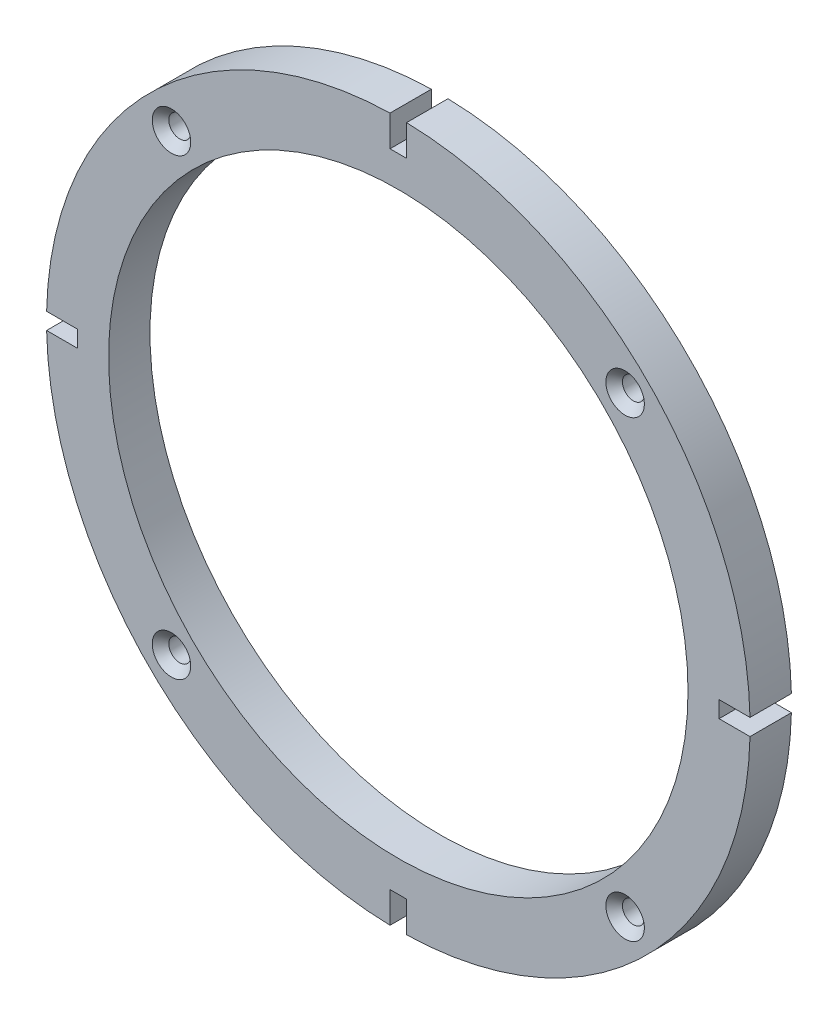
from build123d import *

# Parameters (mm, degrees)
SKETCH1_R                  = 70
BOSS_EXTRUDE1_DEPTH        = 10
SKETCH2_R                  = 2.65
WYTNIJ_WYCI_GNI_CIE1_DEPTH = 10
SZKIC1_R                   = 5
WYTNIJ_WYCI_GNI_CIE2_DEPTH = 2
SZYK_KO_OWY1_COUNT         = 4
SFAZOWANIE1_SIZE           = 2


with BuildPart() as part:
    # Sketch1 → Boss-Extrude1 (new body)
    with BuildSketch(Plane.XY):
        with BuildLine():
            ThreePointArc((2, -84.976467331), (60.104076401, -60.104076401), (84.976467331, -2))
            Line((84.976467331, -2), (77.499555144, -2))
            Line((77.499555144, -2), (77.499555144, 2))
            Line((77.499555144, 2), (84.976467331, 2))
            ThreePointArc((84.976467331, 2), (60.104076401, 60.104076401), (2, 84.976467331))
            Line((2, 84.976467331), (2, 77.499555144))
            Line((2, 77.499555144), (-2, 77.499555144))
            Line((-2, 77.499555144), (-2, 84.976467331))
            ThreePointArc((-2, 84.976467331), (-60.104076401, 60.104076401), (-84.976467331, 2))
            Line((-84.976467331, 2), (-77.499555144, 2))
            Line((-77.499555144, 2), (-77.499555144, -2))
            Line((-77.499555144, -2), (-84.976467331, -2))
            ThreePointArc((-84.976467331, -2), (-60.104076401, -60.104076401), (-2, -84.976467331))
            Line((-2, -84.976467331), (-2, -77.499555144))
            Line((-2, -77.499555144), (2, -77.499555144))
            Line((2, -77.499555144), (2, -84.976467331))
        make_face()
        Circle(SKETCH1_R, mode=Mode.SUBTRACT)
    extrude(amount=BOSS_EXTRUDE1_DEPTH)

    # Sketch2 → Wytnij-wyciągnięcie1 (cut)
    with BuildSketch(Plane(origin=(0, 0, 0), x_dir=(-1, 0, 0), z_dir=(0, 0, -1))):
        with Locations((-54.800775542, 54.800775542)):
            Circle(SKETCH2_R)
        with Locations((54.800775542, 54.800775542)):
            Circle(SKETCH2_R)
        with Locations((54.800775542, -54.800775542)):
            Circle(SKETCH2_R)
        with Locations((-54.800775542, -54.800775542)):
            Circle(SKETCH2_R)
    extrude(amount=-WYTNIJ_WYCI_GNI_CIE1_DEPTH, mode=Mode.SUBTRACT)

    # Szkic1 → Wytnij-wyciągnięcie2 (cut)
    with BuildSketch(Plane(origin=(0, 0, 0), x_dir=(-1, 0, 0), z_dir=(0, 0, -1))):
        with Locations((-54.800775542, 54.800775542)):
            Circle(SZKIC1_R)
    wytnij_wyci_gni_cie2 = extrude(amount=-WYTNIJ_WYCI_GNI_CIE2_DEPTH, mode=Mode.SUBTRACT)

    # Szyk kołowy1: Wytnij-wyciągnięcie2 ×4 about axis
    szyk_ko_owy1_axis = Axis((0, 0, 10), (0, 0, -1))
    for i in range(1, SZYK_KO_OWY1_COUNT):
        add(wytnij_wyci_gni_cie2.rotate(szyk_ko_owy1_axis, i * 360 / SZYK_KO_OWY1_COUNT), mode=Mode.SUBTRACT)

    # Sfazowanie1
    sfazowanie1_edges = [part.edges().sort_by_distance(p)[0] for p in [
        (57.450775542, -54.800775542, 10),
        (57.450775542, 54.800775542, 10),
        (-52.150775542, 54.800775542, 10),
        (-52.150775542, -54.800775542, 10),
    ]]
    chamfer(sfazowanie1_edges, length=SFAZOWANIE1_SIZE)


solid = part.part
